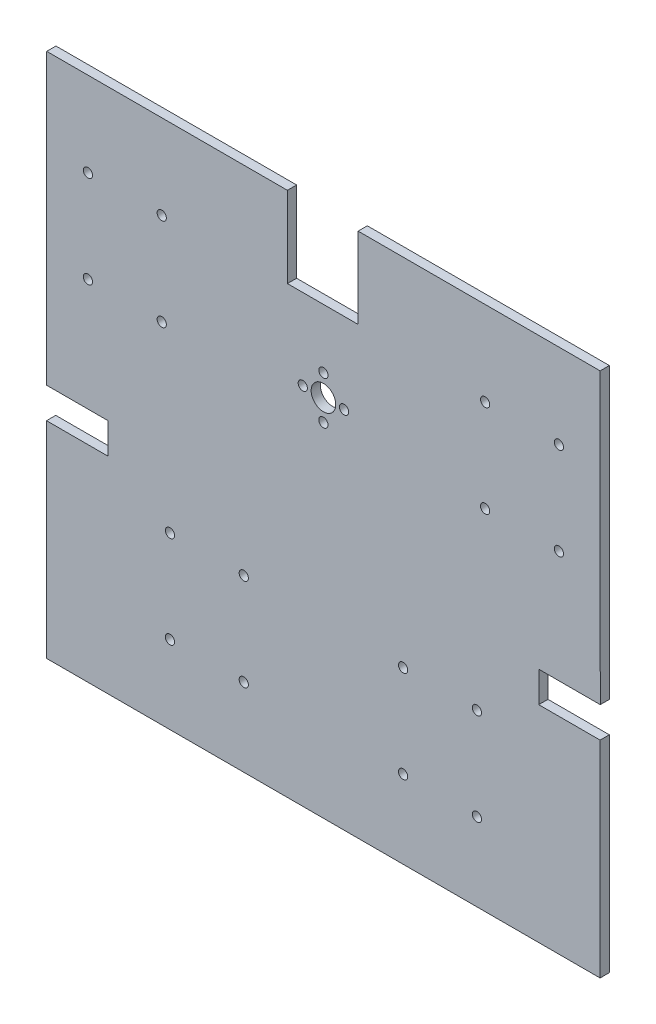
from build123d import *

# Parameters (mm, degrees)
SKETCH2_4_R         = 1.5
SKETCH2_4_R_2       = 4
BOSS_EXTRUDE3_DEPTH = 3


with BuildPart() as part:
    # Sketch2<4> → Boss-Extrude3 (new body)
    with BuildSketch(Plane.XY):
        Polygon((11.285537083, 67.426381387), (-11.714462917, 67.426381387), (-11.714462917, 93.699876832), (-89.981085749, 93.699876832), (-90.049434029, -0.350359539), (-70.049434029, -0.350359539), (-70.049434029, -10.350359539), (-90.049434029, -10.350359539), (-90.049434029, -77.292428593), (89.966856189, -77.292428593), (89.966856189, -10.294249841), (70.02051513, -10.294249841), (70.02051513, -0.294249841), (90.02051513, -0.294249841), (89.979640637, 93.699876832), (11.285537083, 93.699876832), align=None)
        with Locations((-49.910451967, -51.897791457)):
            Circle(SKETCH2_4_R, mode=Mode.SUBTRACT)
        with Locations((-25.910451967, -51.897791457)):
            Circle(SKETCH2_4_R, mode=Mode.SUBTRACT)
        with Locations((-49.910451967, -21.897791457)):
            Circle(SKETCH2_4_R, mode=Mode.SUBTRACT)
        with Locations((-25.910451967, -21.897791457)):
            Circle(SKETCH2_4_R, mode=Mode.SUBTRACT)
        with Locations((25.910451967, -51.897791457)):
            Circle(SKETCH2_4_R, mode=Mode.SUBTRACT)
        with Locations((49.910451967, -51.897791457)):
            Circle(SKETCH2_4_R, mode=Mode.SUBTRACT)
        with Locations((25.910451967, -21.897791457)):
            Circle(SKETCH2_4_R, mode=Mode.SUBTRACT)
        with Locations((49.910451967, -21.897791457)):
            Circle(SKETCH2_4_R, mode=Mode.SUBTRACT)
        with Locations((-76.575718441, 36.212475152)):
            Circle(SKETCH2_4_R, mode=Mode.SUBTRACT)
        with Locations((-52.575718441, 36.212475152)):
            Circle(SKETCH2_4_R, mode=Mode.SUBTRACT)
        with Locations((-0.015444999, 34.177087285)):
            Circle(SKETCH2_4_R, mode=Mode.SUBTRACT)
        with Locations((-6.710109502, 41.177087285)):
            Circle(SKETCH2_4_R, mode=Mode.SUBTRACT)
        with Locations((-0.015444999, 48.177087285)):
            Circle(SKETCH2_4_R, mode=Mode.SUBTRACT)
        with Locations((-76.575718441, 66.212475152)):
            Circle(SKETCH2_4_R, mode=Mode.SUBTRACT)
        with Locations((-52.575718441, 66.212475152)):
            Circle(SKETCH2_4_R, mode=Mode.SUBTRACT)
        with Locations((0, 41.177087285)):
            Circle(SKETCH2_4_R_2, mode=Mode.SUBTRACT)
        with Locations((6.710109502, 41.177087285)):
            Circle(SKETCH2_4_R, mode=Mode.SUBTRACT)
        with Locations((52.575718441, 36.212475152)):
            Circle(SKETCH2_4_R, mode=Mode.SUBTRACT)
        with Locations((76.575718441, 36.212475152)):
            Circle(SKETCH2_4_R, mode=Mode.SUBTRACT)
        with Locations((52.575718441, 66.212475152)):
            Circle(SKETCH2_4_R, mode=Mode.SUBTRACT)
        with Locations((76.575718441, 66.212475152)):
            Circle(SKETCH2_4_R, mode=Mode.SUBTRACT)
    extrude(amount=BOSS_EXTRUDE3_DEPTH)


solid = part.part
